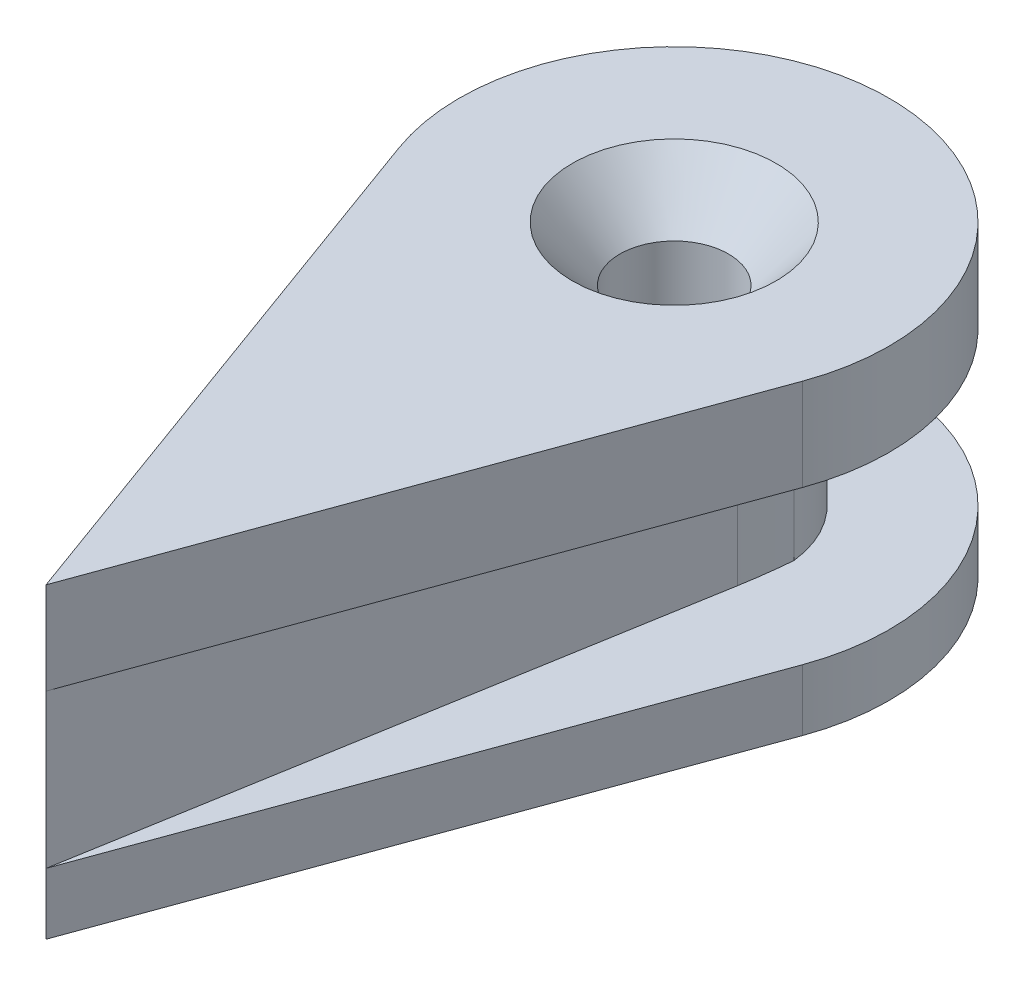
from build123d import *

# Parameters (mm, degrees)
SKETCH1_R                                      = 8.89
BOSS_EXTRUDE1_DEPTH                            = 12.7
CUT_EXTRUDE2_START                             = -10.16
CUT_EXTRUDE2_DEPTH                             = 6.35
CSK_FOR_8_FLAT_HEAD_MACHINE_SCREW1_D           = 4.4958
CSK_FOR_8_FLAT_HEAD_MACHINE_SCREW1_CSINK_D     = 8.4328
CSK_FOR_8_FLAT_HEAD_MACHINE_SCREW1_CSINK_ANGLE = 82
FILLET1_R                                      = 25.4


with BuildPart() as part:
    # Sketch1 → Boss-Extrude1 (new body)
    with BuildSketch(Plane(origin=(0, 0, 0), x_dir=(1, 0, 0), z_dir=(0, 1, 0))):
        Circle(SKETCH1_R)
        with BuildLine():
            Line((0, -25.992621117), (8.353867399, -3.040559074))
            ThreePointArc((8.353867399, -3.040559074), (0, -8.89), (-8.353867399, -3.040559074))
            Line((-8.353867399, -3.040559074), (0, -25.992621117))
        make_face()
    extrude(amount=BOSS_EXTRUDE1_DEPTH)

    # Sketch5 → Cut-Extrude2 (cut)
    with BuildSketch(Plane(origin=(0, 12.7, 0), x_dir=(1, 0, 0), z_dir=(0, 1, 0)).offset(CUT_EXTRUDE2_START)):
        with BuildLine():
            Line((-4.445, 0), (-4.445, 0.512896595))
            ThreePointArc((-4.445, 0.512896595), (-2.977090499, 3.340362268), (0, 4.474493035))
            Line((0, 4.474493035), (0, 8.89))
            ThreePointArc((0, 8.89), (-7.282261674, 5.099094519), (-8.353867399, -3.040559074))
            Line((-8.353867399, -3.040559074), (0, -25.992621117))
            Line((0, -25.992621117), (-4.445, 0))
        make_face()
    cut_extrude2 = extrude(amount=CUT_EXTRUDE2_DEPTH, mode=Mode.SUBTRACT)

    # CSK for #8 Flat Head Machine Screw1 (through all)
    with Locations(Plane(origin=(0, 12.7, 0), x_dir=(1, 0, 0), z_dir=(0, 1, 0))):
        with Locations((0, 0)):
            CounterSinkHole(CSK_FOR_8_FLAT_HEAD_MACHINE_SCREW1_D / 2, CSK_FOR_8_FLAT_HEAD_MACHINE_SCREW1_CSINK_D / 2, counter_sink_angle=CSK_FOR_8_FLAT_HEAD_MACHINE_SCREW1_CSINK_ANGLE)

    # Mirror1: Cut-Extrude2 across plane
    add(cut_extrude2.mirror(Plane(origin=(0, 0, 0), x_dir=(0, 0, 1), z_dir=(1, 0, 0))), mode=Mode.SUBTRACT)

    # Fillet1
    # the kernel refuses this fillet: 25.4 mm, written as the material it takes off along each edge
    with BuildSketch(Plane(origin=(-4.445, 2.54, 0), x_dir=(0, 0, -1), z_dir=(0, 1, 0))) as fillet1_piece_1:
        with BuildLine():
            CenterArc((2.715876885, -25.30428576), FILLET1_R, 94.975600716, 4.728682493)
            Line((-1.565625003, -0.267737644), (-1.65125504, 0.232993318))
            Line((-1.65125504, 0.232993318), (-0.085630038, 0.500730962))
            Line((-0.085630038, 0.500730962), (0, 0.508))
            ThreePointArc((0, 0.508), (0.256448297, 0.508), (0.468836989, 0.506085715))
            Line((0.468836989, 0.506085715), (0.512896595, 0))
        make_face()
    extrude(amount=6.35, mode=Mode.SUBTRACT)
    with BuildSketch(Plane(origin=(4.445, 2.54, 0), x_dir=(-0.16856306644022723, 0, 0.9856908707258414), z_dir=(0, 1, 0))) as fillet1_piece_2:
        with BuildLine():
            CenterArc((1.58835295, -25.4), FILLET1_R, 90, 4.728682493)
            Line((-0.505557491, -0.086455423), (-0.5474357, 0.419815469))
            ThreePointArc((-0.5474357, 0.419815469), (-0.338408783, 0.457503251), (-0.085630038, 0.500730962))
            Line((-0.085630038, 0.500730962), (0, 0.508))
            Line((0, 0.508), (1.58835295, 0.508))
            Line((1.58835295, 0.508), (1.58835295, 0))
        make_face()
    extrude(amount=6.35, mode=Mode.SUBTRACT)


solid = part.part
